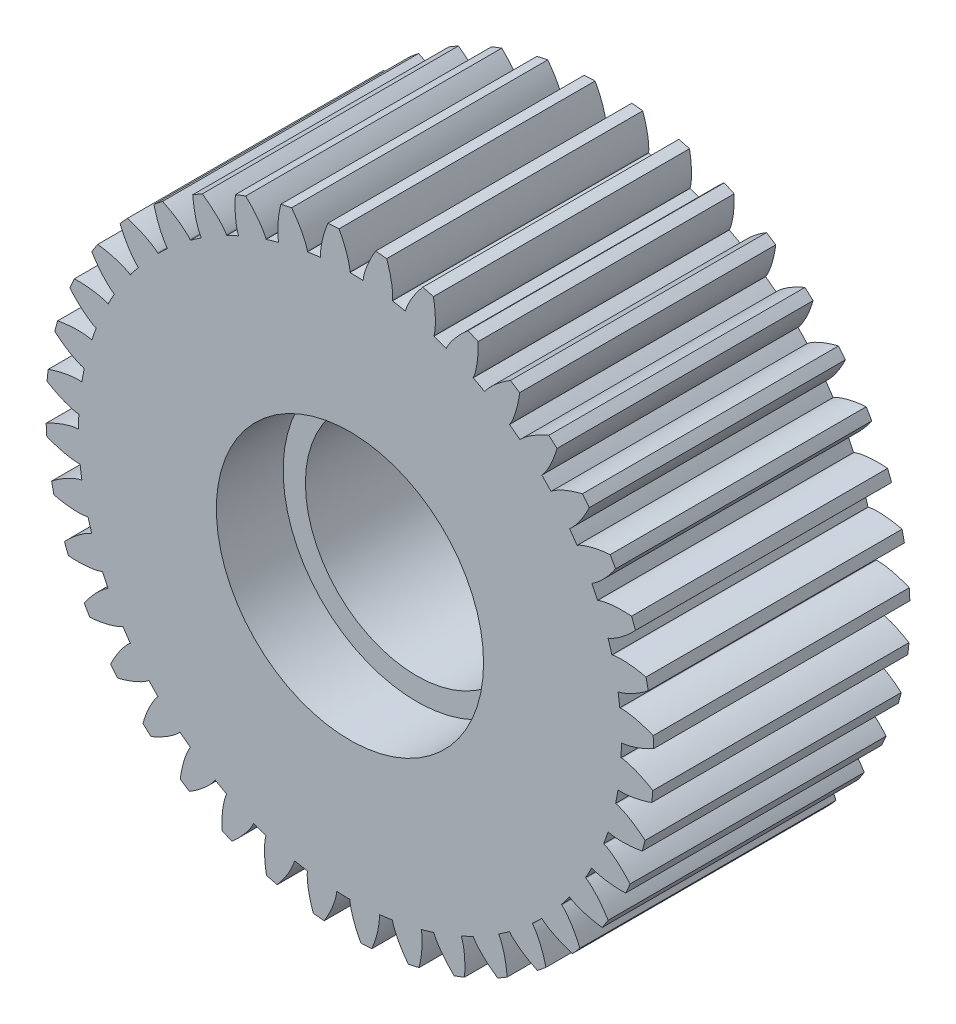
from build123d import *

# Parameters (mm, degrees)
SKETCH1_R           = 13.65
BOSS_EXTRUDE1_DEPTH = 5.75
CUT_EXTRUDE1_DEPTH  = 21.142182106
CIRPATTERN2_COUNT   = 40
SKETCH3_R           = 6
CUT_EXTRUDE2_DEPTH  = 3
SKETCH4_R           = 5
CUT_EXTRUDE3_DEPTH  = 22.081048982


with BuildPart() as part:
    # Sketch1 → Boss-Extrude1 (new, symmetric)
    with BuildSketch(Plane.XY):
        Circle(SKETCH1_R)
    extrude(amount=BOSS_EXTRUDE1_DEPTH, both=True)

    # Sketch2 → Cut-Extrude1 (cut, symmetric)
    with BuildSketch(Plane.XY):
        with BuildLine():
            add(Edge.make_bspline(
                [(12.21600407, 0), (12.220180158, 6.0081e-05), (12.231890106, 0.000414649), (12.254012579, 0.001819651), (12.290063246, 0.005154826), (12.335907985, 0.010935296), (12.395023271, 0.020161592), (12.464447367, 0.033283183), (12.540473293, 0.05005789), (12.622849789, 0.070841139), (12.704699251, 0.093809212), (12.786004695, 0.118792827), (12.8666663, 0.145544819), (12.963945928, 0.180143838), (13.079976337, 0.224676123), (13.214604806, 0.281135026), (13.366049859, 0.350349191), (13.492916386, 0.413441207), (13.579907775, 0.458996338), (13.629207223, 0.485639136), (13.641125668, 0.492128538)],
                knots=[0, 0, 0, 0, 0, 0.005376749, 0.015083688, 0.02853182, 0.04661014, 0.064854849, 0.092110525, 0.119476176, 0.146842496, 0.174208854, 0.201574956, 0.228941013, 0.256307345, 0.307035032, 0.361767352, 0.416499661, 0.471231937, 0.488701645, 0.488701645, 0.488701645, 0.488701645, 0.488701645], degree=4))
            Line((12.21600407, 0), (12.1875, 0))
            ThreePointArc((12.1875, 0), (12.183882449, -0.296925446), (12.173031943, -0.593674622))
            Line((12.173031943, -0.593674622), (12.201502176, -0.595063105))
            add(Edge.make_bspline(
                [(12.201502176, -0.595063105), (12.20567038, -0.595326539), (12.217349154, -0.596251099), (12.239376925, -0.598732057), (12.275222333, -0.603819365), (12.320731072, -0.611826151), (12.379326752, -0.623921104), (12.448029258, -0.640408888), (12.523147806, -0.660867038), (12.604414122, -0.685638319), (12.685047603, -0.712566159), (12.765039532, -0.741480646), (12.844302245, -0.77213005), (12.939781011, -0.811426657), (13.053504432, -0.861558123), (13.185222867, -0.924507993), (13.333116592, -1.001017147), (13.456759189, -1.070214158), (13.541428239, -1.119952713), (13.589371344, -1.148965346), (13.600959531, -1.156027613)],
                knots=[0, 0, 0, 0, 0, 0.005376749, 0.015083688, 0.02853182, 0.04661014, 0.064854849, 0.092110525, 0.119476176, 0.146842496, 0.174208854, 0.201574956, 0.228941013, 0.256307345, 0.307035032, 0.361767352, 0.416499661, 0.471231937, 0.488701645, 0.488701645, 0.488701645, 0.488701645, 0.488701645], degree=4))
            ThreePointArc((13.600959531, -1.156027613), (13.637734372, -0.578533666), (13.65, 0))
            ThreePointArc((13.65, 0), (13.647781237, 0.246104272), (13.641125668, 0.492128538))
        make_face()
    cut_extrude1 = extrude(amount=CUT_EXTRUDE1_DEPTH, both=True, mode=Mode.SUBTRACT)

    # CirPattern2: Cut-Extrude1 ×40 about axis
    cirpattern2_axis = Axis((0, 0, 5.75), (0, 0, -1))
    for i in range(1, CIRPATTERN2_COUNT):
        add(cut_extrude1.rotate(cirpattern2_axis, i * 360 / CIRPATTERN2_COUNT), mode=Mode.SUBTRACT)

    # Sketch3 → Cut-Extrude2 (cut)
    with BuildSketch(Plane.XY.offset(5.75)):
        Circle(SKETCH3_R)
    cut_extrude2 = extrude(amount=-CUT_EXTRUDE2_DEPTH, mode=Mode.SUBTRACT)

    # Sketch4 → Cut-Extrude3 (cut, through all)
    with BuildSketch(Plane.XY.offset(2.75)):
        Circle(SKETCH4_R)
    extrude(amount=-CUT_EXTRUDE3_DEPTH, mode=Mode.SUBTRACT)

    # Mirror1: Cut-Extrude2 across plane
    add(cut_extrude2.mirror(Plane.XY), mode=Mode.SUBTRACT)


solid = part.part
